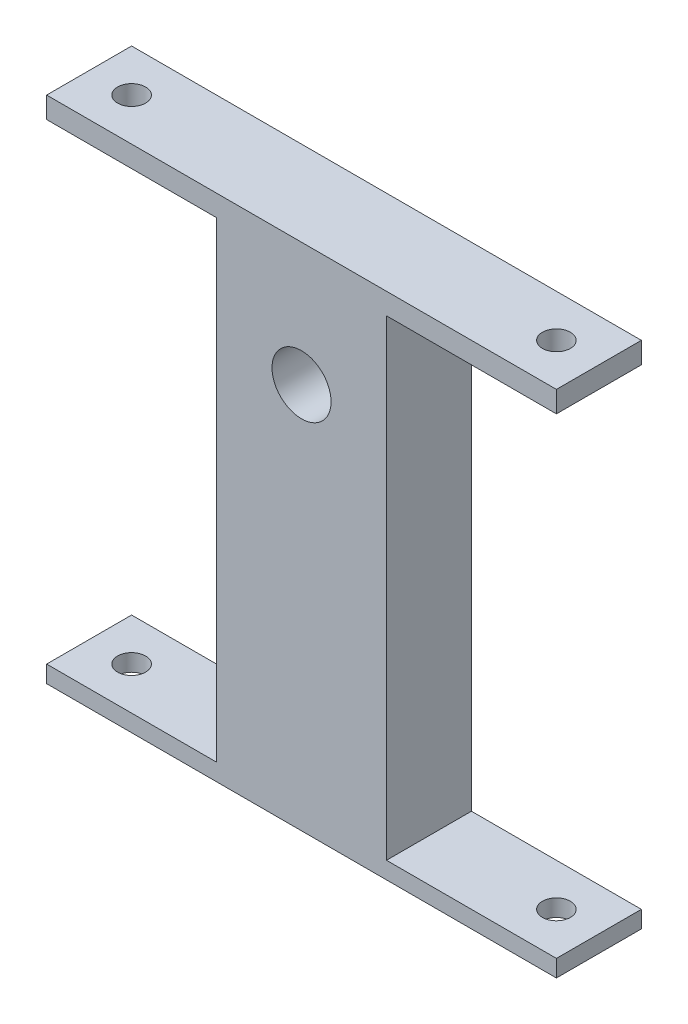
from build123d import *

# Parameters (mm, degrees)
SKETCH1_R                    = 3.475
BOSS_EXTRUDE1_DEPTH          = 10
ENL_V_MAT_EXTRU_1_DEPTH      = 68.823299831
ENL_V_MAT_EXTRU_1_DEPTH_BACK = 68.823299831
ESQUISSE1_R                  = 1.65


with BuildPart() as part:
    # Sketch1 → Boss-Extrude1 (new body)
    with BuildSketch(Plane.XY):
        Polygon((-30, 30), (-30, 27.5), (-10, 27.5), (-10, -28), (-30, -28), (-30, -30), (30, -30), (30, -28), (10, -28), (10, 27.5), (30, 27.5), (30, 30), align=None)
        with Locations((0, 15.47)):
            Circle(SKETCH1_R, mode=Mode.SUBTRACT)
    extrude(amount=BOSS_EXTRUDE1_DEPTH)

    # Esquisse1 → Enlèv. mat.-Extru.1 (cut, two sides: drawn at the far end of the back side and taken through both)
    with BuildSketch(Plane(origin=(0, 30, 0), x_dir=(1, 0, 0), z_dir=(0, 1, 0)).offset(-ENL_V_MAT_EXTRU_1_DEPTH_BACK)):
        with Locations((25, -5)):
            Circle(ESQUISSE1_R)
        with Locations((-25, -5)):
            Circle(ESQUISSE1_R)
    extrude(amount=ENL_V_MAT_EXTRU_1_DEPTH + ENL_V_MAT_EXTRU_1_DEPTH_BACK, mode=Mode.SUBTRACT)


solid = part.part
